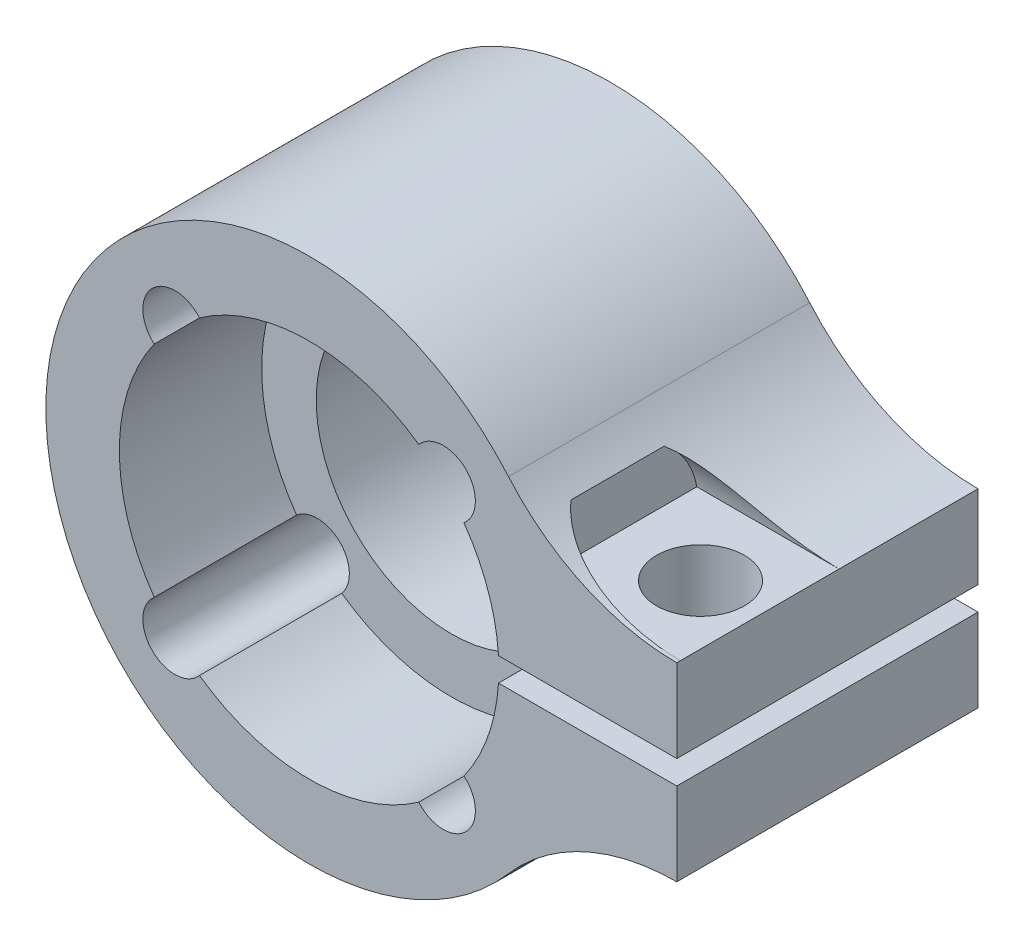
from build123d import *

# Parameters (mm, degrees)
CUT_EXTRUDE1_START     = -12.7
CUT_EXTRUDE1_DEPTH     = 12.7
CUT_EXTRUDE1_START_2   = -7.233059634
CUT_EXTRUDE1_2_DEPTH   = 7.233059634
CUT_EXTRUDE1_3_DEPTH   = 6
CUT_EXTRUDE1_4_DEPTH   = 1.533059634
CUT_EXTRUDE1_START_3   = 9.5
CUT_EXTRUDE1_5_DEPTH   = 6.5
SKETCH3_W              = 1.3525
SKETCH3_H              = 10.6
M2_5_CLEARANCE_HOLE2_D = 2.705
SKETCH7_W              = 1.85
SKETCH7_H              = 10.6


with BuildPart() as part:
    # Cut-Extrude1: read off the stored shape, not the designer's step
    # Cut-Extrude1 outline → Cut-Extrude1 (new body)
    with BuildSketch(Plane(origin=(0, 0, -12.7), x_dir=(-1, 0, 0), z_dir=(0, 0, -1)).offset(CUT_EXTRUDE1_START)):
        with BuildLine():
            Line((-5.678027827, -0.5), (-15.5, -0.5))
            Line((-15.5, -0.5), (-15.5, -4))
            ThreePointArc((-15.5, -4), (-11.598248501, -4.851105882), (-8.405387738, -7.249790133))
            ThreePointArc((-8.405387738, -7.249790133), (11.1, 0), (-8.405387738, 7.249790133))
            ThreePointArc((-8.405387738, 7.249790133), (-8.930606577, 6.689081827), (-9.5, 6.173291403))
            Line((-9.5, 6.173291403), (-9.5, 4))
            Line((-9.5, 4), (-15.5, 4))
            Line((-15.5, 4), (-15.5, 0.5))
            Line((-15.5, 0.5), (-5.678027827, 0.5))
            ThreePointArc((-5.678027827, 0.5), (-5.7, 0), (-5.678027827, -0.5))
        make_face()
    extrude(amount=CUT_EXTRUDE1_DEPTH)

    # Cut-Extrude1 2 outline → Cut-Extrude1 2 (add)
    with BuildSketch(Plane(origin=(0, 0, -12.7), x_dir=(-1, 0, 0), z_dir=(0, 0, -1)).offset(CUT_EXTRUDE1_START_2)):
        with BuildLine():
            ThreePointArc((-9.5, 6.173291403), (-12.309263583, 4.560062613), (-15.5, 4))
            Line((-15.5, 4), (-9.5, 4))
            Line((-9.5, 4), (-9.5, 6.173291403))
        make_face()
    extrude(amount=CUT_EXTRUDE1_2_DEPTH)

    # Cut-Extrude1 3 outline → Cut-Extrude1 3 (add)
    with BuildSketch(Plane(origin=(0, 0, -12.7), x_dir=(-1, 0, 0), z_dir=(0, 0, -1)).offset(CUT_EXTRUDE1_START)):
        with BuildLine():
            ThreePointArc((-7.984359711, 0.5), (-8, 0), (-7.984359711, -0.5))
            Line((-7.984359711, -0.5), (-5.678027827, -0.5))
            ThreePointArc((-5.678027827, -0.5), (-5.7, 0), (-5.678027827, 0.5))
            Line((-5.678027827, 0.5), (-7.984359711, 0.5))
        make_face()
    extrude(amount=CUT_EXTRUDE1_3_DEPTH)

    # Cut-Extrude1 4 outline → Cut-Extrude1 4 (add)
    with BuildSketch(Plane(origin=(0, 0, -12.7), x_dir=(-1, 0, 0), z_dir=(0, 0, -1)).offset(CUT_EXTRUDE1_START)):
        with BuildLine():
            ThreePointArc((-9.5, 6.173291403), (-12.309263583, 4.560062613), (-15.5, 4))
            Line((-15.5, 4), (-9.5, 4))
            Line((-9.5, 4), (-9.5, 6.173291403))
        make_face()
    extrude(amount=CUT_EXTRUDE1_4_DEPTH)

    # Cut-Extrude1 5 outline → Cut-Extrude1 5 (cut)
    with BuildSketch(Plane.YZ.offset(CUT_EXTRUDE1_START_3)):
        with BuildLine():
            ThreePointArc((6.173291403, -1.533059534), (5.2222696, -0.629576076), (4, -0.153359894))
            Line((4, -0.153359894), (4, -1.533059634))
            Line((4, -1.533059634), (6.173291403, -1.533059534))
        make_face()
        with BuildLine():
            Line((6.173291403, -5.466940466), (4, -5.466940366))
            Line((4, -5.466940366), (4, -6.846640106))
            ThreePointArc((4, -6.846640106), (5.2222696, -6.370423924), (6.173291403, -5.466940466))
        make_face()
    extrude(amount=CUT_EXTRUDE1_5_DEPTH, mode=Mode.SUBTRACT)

    # Sketch2 → Cut-Revolve1 (revolve, cut)
    with BuildSketch(Plane(origin=(0, 0, 0), x_dir=(1, 0, 0), z_dir=(0, 1, 0))):
        Polygon((5.7, 12.7), (0, 12.7), (0, 0), (8, 0), (8, 6), (5.7, 6), align=None)
    revolve(axis=Axis((0, 0, -12.7), (0, 0, 1)), mode=Mode.SUBTRACT)

    # Sketch3 → M2.5 Clearance Hole1 (revolve, cut)
    with BuildSketch(Plane(origin=(13, -0.5, -3.5), x_dir=(0, 0, 1), z_dir=(1, 0, 0))):
        with Locations((0.67625, 5.3)):
            Rectangle(SKETCH3_W, SKETCH3_H)
    revolve(axis=Axis((13, 5.85, -3.5), (0, -1, 0)), mode=Mode.SUBTRACT)

    # M2.5 Clearance Hole2 (through all)
    with Locations(Plane(origin=(0, 0, -12.7), x_dir=(-1, 0, 0), z_dir=(0, 0, -1))):
        with Locations((-5.656854249, -5.656854249), (5.656854249, -5.656854249), (5.656854249, 5.656854249), (-5.656854249, 5.656854249)):
            Hole(M2_5_CLEARANCE_HOLE2_D / 2)

    # Sketch7 → Ø3.7 (3.7) Diameter Hole1 (revolve, cut)
    with BuildSketch(Plane(origin=(13, 0.5, -3.5), x_dir=(0, 0, -1), z_dir=(1, 0, 0))):
        with Locations((0.925, 5.3)):
            Rectangle(SKETCH7_W, SKETCH7_H)
    revolve(axis=Axis((13, -5.85, -3.5), (0, 1, 0)), mode=Mode.SUBTRACT)


solid = part.part
